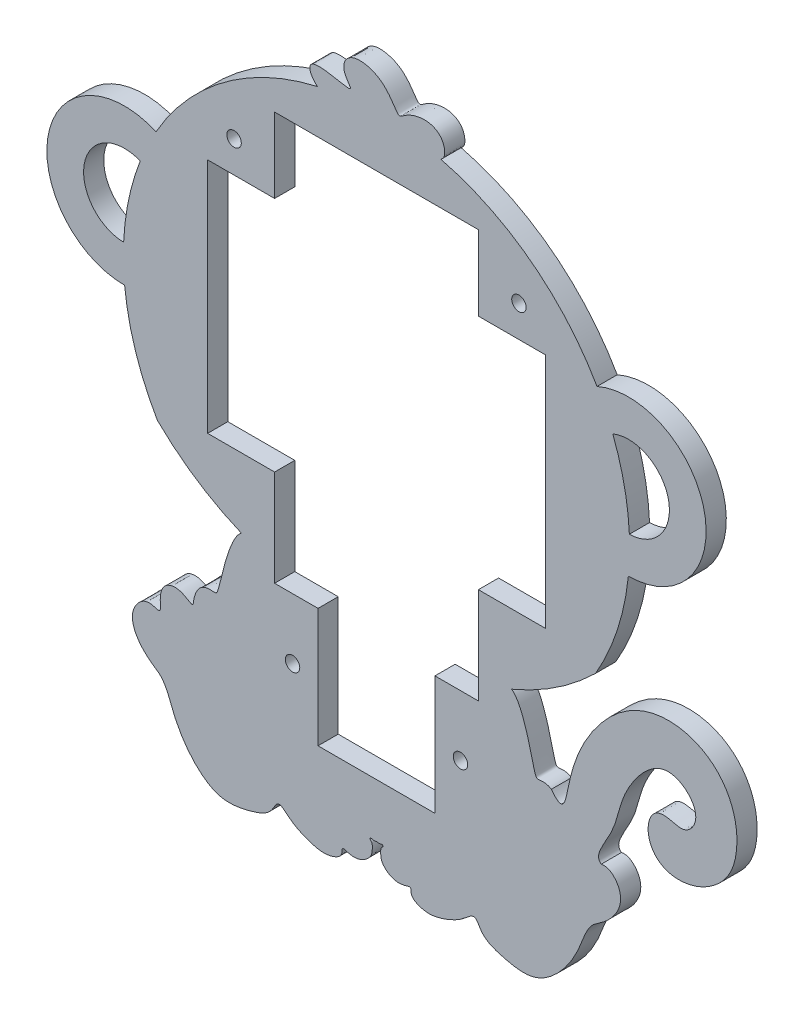
from build123d import *

# Parameters (mm, degrees)
MODEL_R             = 1.7
BOSS_EXTRUDE1_DEPTH = 4.75


with BuildPart() as part:
    # Model → Boss-Extrude1 (new body)
    with BuildSketch(Plane.XY):
        with BuildLine():
            add(Edge.make_bspline(
                [(-323.003936738, 396.327251189), (-322.639135583, 396.079204413), (-322.18920374, 395.634433922), (-321.658390696, 394.898644088), (-321.051857816, 393.757203334), (-320.383735374, 392.131003368), (-319.977262023, 391.014654975), (-319.584917193, 389.819275468), (-319.135868658, 388.323421516), (-318.721860717, 386.804935246), (-318.353600889, 385.34636593), (-318.038508773, 384.035346949), (-317.773489578, 382.944281063), (-317.579832511, 382.209449772), (-317.401157087, 381.664820315), (-317.218450591, 381.31109681), (-317.003689416, 381.129911234), (-316.721708308, 381.082225409), (-316.343707995, 381.115525432), (-315.861762853, 381.169472404), (-315.293993546, 381.182617586), (-314.716438841, 381.105097359), (-314.256472836, 380.951412883), (-313.932453608, 380.783648044), (-313.737120758, 380.657216991), (-313.6607794, 380.60362174)],
                knots=[0, 0, 0, 0, 0, 0, 0.02, 0.025, 0.03, 0.035, 0.04, 0.045, 0.05, 0.06, 0.065, 0.07, 0.075, 0.08, 0.085, 0.09, 0.095, 0.1, 0.105, 0.11, 0.115, 0.12, 0.123294018, 0.123294018, 0.123294018, 0.123294018, 0.123294018, 0.123294018], degree=5))
            ThreePointArc((-323.003936738, 396.327251189), (-312.498766528, 401.927835806), (-303.24831057, 409.421447336))
            ThreePointArc((-303.24831057, 409.421447336), (-298.124131535, 420.844790734), (-295.53920269, 433.095020448))
            ThreePointArc((-295.53920269, 433.095020448), (-277.643269068, 455.12113969), (-302.913653982, 468.037099404))
            ThreePointArc((-302.913653982, 468.037099404), (-318.490243046, 485.80537303), (-339.811140885, 495.991686882))
            add(Edge.make_bspline(
                [(-368.648535438, 496.252173352), (-368.744458236, 496.318852064), (-368.933155722, 496.46135137), (-369.206763211, 496.702529524), (-369.552638711, 497.078952875), (-369.945448044, 497.635151945), (-370.27396009, 498.258937778), (-370.49029081, 498.914952019), (-370.51070775, 499.541563445), (-370.238365938, 500.064302422), (-369.5990972, 500.417471707), (-368.57162488, 500.562380095), (-367.22355688, 500.508813977), (-365.687080465, 500.304348965), (-364.130399482, 500.021394498), (-362.730437113, 499.744991582), (-361.645780778, 499.560560003), (-360.987783845, 499.541133492), (-360.796409046, 499.736067669), (-361.003653893, 500.155847055), (-361.456239643, 500.775355547), (-361.969645158, 501.546412025), (-362.368346783, 502.406968262), (-362.540769792, 503.292531993), (-362.454363932, 504.143316727), (-362.127001431, 504.906996063), (-361.609010526, 505.54285956), (-360.962354705, 506.024792223), (-360.237689537, 506.346315269), (-359.465109655, 506.519028644), (-358.662050204, 506.563781119), (-357.836770513, 506.503364206), (-356.993360104, 506.355416269), (-356.136711355, 506.123246396), (-355.27524615, 505.794703449), (-354.419874931, 505.352916652), (-353.583850229, 504.783872945), (-352.782377599, 504.085819177), (-352.032065864, 503.276653785), (-351.351103862, 502.405268117), (-350.756796891, 501.550400765), (-350.259062752, 500.800910062), (-349.854900796, 500.240489256), (-349.52240587, 499.930593307), (-349.215031159, 499.894076524), (-348.855526802, 500.098537748), (-348.362085472, 500.475509867), (-347.67170771, 500.938251599), (-346.770031422, 501.402187782), (-345.688786994, 501.792289415), (-344.48987856, 502.045099565), (-343.253856136, 502.112491058), (-342.066559862, 501.964757688), (-341.006667622, 501.593968073), (-340.132609258, 501.01739116), (-339.470394525, 500.280534755), (-339.021946768, 499.447136213), (-338.772548612, 498.589873373), (-338.698846344, 497.780410896), (-338.775989921, 497.080683391), (-338.986639614, 496.531262609), (-339.255348506, 496.227388525), (-339.511863577, 496.0787419), (-339.707309513, 496.014838841), (-339.811140885, 495.991686882)],
                knots=[0, 0, 0, 0, 0, 0, 0.016666667, 0.033333333, 0.05, 0.066666667, 0.083333333, 0.1, 0.116666667, 0.133333333, 0.15, 0.166666667, 0.183333333, 0.2, 0.216666667, 0.233333333, 0.25, 0.266666667, 0.283333333, 0.3, 0.316666667, 0.333333333, 0.35, 0.366666667, 0.383333333, 0.4, 0.416666667, 0.433333333, 0.45, 0.466666667, 0.483333333, 0.5, 0.516666667, 0.533333333, 0.55, 0.566666667, 0.583333333, 0.6, 0.616666667, 0.633333333, 0.65, 0.666666667, 0.683333333, 0.7, 0.716666667, 0.733333333, 0.75, 0.766666667, 0.783333333, 0.8, 0.816666667, 0.833333333, 0.85, 0.866666667, 0.883333333, 0.9, 0.916666667, 0.933333333, 0.95, 0.966666667, 0.983333333, 1, 1, 1, 1, 1, 1], degree=5))
            ThreePointArc((-368.648535438, 496.252173352), (-390.614540969, 486.143224047), (-406.641533995, 468.037099404))
            ThreePointArc((-406.641533995, 468.037099404), (-431.911918909, 455.12113969), (-414.015985287, 433.095020448))
            ThreePointArc((-414.015985287, 433.095020448), (-411.431056442, 420.844790734), (-406.306877408, 409.421447336))
            ThreePointArc((-406.306877408, 409.421447336), (-397.05642145, 401.927835806), (-386.551251239, 396.327251189))
            add(Edge.make_bspline(
                [(-386.551251239, 396.327251189), (-386.916052394, 396.079204413), (-387.365984237, 395.634433922), (-387.896797281, 394.898644088), (-388.503330161, 393.757203334), (-389.171452603, 392.131003368), (-389.577925954, 391.014654975), (-389.970270784, 389.819275468), (-390.419319319, 388.323421516), (-390.83332726, 386.804935246), (-391.201587088, 385.34636593), (-391.516679205, 384.035346949), (-391.781698399, 382.944281063), (-391.975355466, 382.209449772), (-392.15403089, 381.664820315), (-392.336737386, 381.31109681), (-392.551498562, 381.129911234), (-392.833479669, 381.082225409), (-393.211479982, 381.115525432), (-393.693425125, 381.169472404), (-394.261194431, 381.182617586), (-394.881047474, 381.099420015), (-395.510435114, 380.877573231), (-396.105936728, 380.494485307), (-396.631517428, 379.95585235), (-397.063963964, 379.297531395), (-397.39210439, 378.573969962), (-397.617276013, 377.849585475), (-397.753517497, 377.188797135), (-397.82736951, 376.647023839), (-397.879059879, 376.260334721), (-397.959633552, 376.038465419), (-398.114782848, 375.972462073), (-398.366034123, 376.040823891), (-398.706936261, 376.21469148), (-399.120091801, 376.460086445), (-399.591458011, 376.741171495), (-400.117952431, 377.022315753), (-400.699774201, 377.268862798), (-401.463798734, 377.484035353), (-402.300244633, 377.553822048), (-403.174091852, 377.426716269), (-404.002173047, 377.065864722), (-404.698224792, 376.46441147), (-405.153470998, 375.811835942), (-405.461269956, 375.032169593), (-405.619922332, 374.166940367), (-405.657953521, 373.27889911), (-405.626485489, 372.442499072), (-405.587522811, 371.731075977), (-405.603727217, 371.205296174), (-405.727364814, 370.900755869), (-405.990085682, 370.81668236), (-406.39105056, 370.902146782), (-406.905602715, 371.07475403), (-407.496249881, 371.243305804), (-408.122207542, 371.327500075), (-408.751072773, 371.282728006), (-409.35960202, 371.097539496), (-409.931191749, 370.782809916), (-410.454421679, 370.36348433), (-410.921225043, 369.869653892), (-411.325051593, 369.32694511), (-411.659572418, 368.750331411), (-411.919102239, 368.147846593), (-412.098696202, 367.522400938), (-412.194371621, 366.874422897), (-412.203287138, 366.20397783), (-412.092164868, 365.237355517), (-411.795780763, 364.240492853), (-411.25356719, 363.0979097), (-410.505546493, 362.004000685), (-409.628552466, 361.020862692), (-408.940714048, 360.363039305), (-408.261699769, 359.795455705), (-407.719269628, 359.383631865), (-407.21381394, 359.028246689), (-406.753242924, 358.71792316), (-406.337217025, 358.432587935), (-405.958407604, 358.146100067), (-405.606436892, 357.832150323), (-405.270933307, 357.469037169), (-404.945150571, 357.045248498), (-404.628769556, 356.563710073), (-404.325203667, 356.036561227), (-404.039420225, 355.480831591), (-403.775511082, 354.913678765), (-403.486293011, 354.234906798), (-403.22438966, 353.563780813), (-402.971971356, 352.893055429), (-402.704512752, 352.203026621), (-402.401681187, 351.478012783), (-402.062584898, 350.721085445), (-401.674639208, 349.927966936), (-401.239024686, 349.111007443), (-400.763113802, 348.289788183), (-400.254340005, 347.481959495), (-399.722634495, 346.692998852), (-399.163365939, 345.932140679), (-398.574323946, 345.19923963), (-397.949478676, 344.488835597), (-397.28186749, 343.797089708), (-396.693729261, 343.232918759), (-395.94666487, 342.573889335), (-395.145878925, 341.947793479), (-394.290902186, 341.375211916), (-393.384167186, 340.882126765), (-392.430043668, 340.491703263), (-391.606002687, 340.243986907), (-390.756002743, 340.079446261), (-389.883129061, 339.998262902), (-388.990604918, 339.995014447), (-388.082210988, 340.060658996), (-387.162607569, 340.183979577), (-386.237707408, 340.353267946), (-385.315001235, 340.557855636), (-384.403963907, 340.789827334), (-383.516286063, 341.045384095), (-382.66652457, 341.327024633), (-381.871318875, 341.642937555), (-381.146754324, 342.002777686), (-380.506140062, 342.414272763), (-379.957720387, 342.879646699), (-379.50217975, 343.391768319), (-379.130782998, 343.931240964), (-378.821858803, 344.461005534), (-378.544703377, 344.932108886), (-378.267774642, 345.29593373), (-377.965518245, 345.51436395), (-377.625879138, 345.570992742), (-377.257148561, 345.481328236), (-376.875804119, 345.278776475), (-376.496250149, 345.00253689), (-376.11706805, 344.682307942), (-375.720845967, 344.335154988), (-375.283150649, 343.970625574), (-374.779103973, 343.593551859), (-374.190278948, 343.207542556), (-373.377688666, 342.741091189), (-372.449841911, 342.284943077), (-371.448923671, 341.861784637), (-370.434447105, 341.496921291), (-369.457107924, 341.211628122), (-368.685864943, 341.035221995), (-367.964373903, 340.924859402), (-367.285516994, 340.881136877), (-366.635919607, 340.902071878), (-366.001452121, 340.984188477), (-365.373937537, 341.123915256), (-364.75630659, 341.318535957), (-364.170945702, 341.568094094), (-363.657947564, 341.87428189), (-363.258368215, 342.235110671), (-362.999601239, 342.639822419), (-362.882834785, 343.065290294), (-362.862380856, 343.467877411), (-362.860328863, 343.794256059), (-362.800804618, 344.002021381), (-362.645316427, 344.082202864), (-362.403915174, 344.064482859), (-362.091030238, 343.983757423), (-361.712216892, 343.868949898), (-361.271123238, 343.746963048), (-360.772201451, 343.643387937), (-360.225145899, 343.584551667), (-359.643851104, 343.593953505), (-359.045609545, 343.68889199), (-358.331130904, 343.914571841), (-357.653031997, 344.271758954), (-357.055699253, 344.71601695), (-356.577458743, 345.17871164), (-356.233391408, 345.621031596), (-356.033125086, 345.975351534), (-355.902737419, 346.342883089), (-355.820827463, 346.757252518), (-355.769760706, 347.236551212), (-355.745106949, 347.759570584), (-355.762413964, 348.248781386), (-355.838587496, 348.623368474), (-355.977712536, 348.837568218), (-356.150848594, 348.941800594), (-356.292732028, 349.075710758), (-356.33646563, 349.288102762), (-356.236344626, 349.443149765), (-355.997125235, 349.455364951), (-355.677539018, 349.382302231), (-355.345578077, 349.318848286), (-355.1000792, 349.319880609), (-354.932396923, 349.356987082), (-354.827970147, 349.397996872), (-354.777593989, 349.422562594)],
                knots=[0, 0, 0, 0, 0, 0, 0.02, 0.025, 0.03, 0.035, 0.04, 0.045, 0.05, 0.06, 0.065, 0.07, 0.075, 0.08, 0.085, 0.09, 0.095, 0.1, 0.105, 0.11, 0.115, 0.12, 0.125, 0.13, 0.135, 0.14, 0.145, 0.15, 0.155, 0.16, 0.165, 0.17, 0.175, 0.18, 0.185, 0.19, 0.195, 0.2, 0.205, 0.21, 0.22, 0.225, 0.23, 0.235, 0.24, 0.245, 0.25, 0.255, 0.26, 0.265, 0.27, 0.275, 0.28, 0.285, 0.29, 0.295, 0.3, 0.305, 0.31, 0.315, 0.32, 0.325, 0.33, 0.335, 0.34, 0.345, 0.35, 0.355, 0.36, 0.375, 0.38, 0.39, 0.395, 0.4, 0.405, 0.41, 0.415, 0.42, 0.425, 0.43, 0.435, 0.44, 0.445, 0.45, 0.455, 0.46, 0.465, 0.47, 0.48, 0.485, 0.49, 0.495, 0.5, 0.51, 0.515, 0.52, 0.525, 0.53, 0.54, 0.545, 0.55, 0.555, 0.56, 0.565, 0.575, 0.58, 0.585, 0.59, 0.595, 0.6, 0.605, 0.61, 0.615, 0.62, 0.625, 0.63, 0.635, 0.64, 0.645, 0.65, 0.655, 0.66, 0.665, 0.67, 0.675, 0.68, 0.685, 0.69, 0.695, 0.7, 0.705, 0.71, 0.715, 0.72, 0.725, 0.73, 0.735, 0.74, 0.745, 0.755, 0.76, 0.765, 0.77, 0.775, 0.78, 0.785, 0.79, 0.795, 0.8, 0.805, 0.81, 0.815, 0.82, 0.825, 0.83, 0.835, 0.84, 0.845, 0.85, 0.855, 0.86, 0.865, 0.87, 0.875, 0.88, 0.885, 0.89, 0.895, 0.905, 0.91, 0.915, 0.92, 0.925, 0.93, 0.935, 0.94, 0.945, 0.95, 0.955, 0.96, 0.965, 0.97, 0.975, 0.98, 0.985, 0.99, 0.995, 1, 1, 1, 1, 1, 1], degree=5))
            add(Edge.make_bspline(
                [(-301.898947089, 371.249991702), (-301.80670497, 371.265018138), (-301.589974955, 371.293910279), (-301.244905456, 371.313674079), (-300.773941346, 371.273545454), (-300.195585957, 371.097539496), (-299.623996228, 370.782809916), (-299.100766299, 370.36348433), (-298.633962934, 369.869653892), (-298.230136384, 369.32694511), (-297.89561556, 368.750331411), (-297.636085738, 368.147846593), (-297.456491776, 367.522400938), (-297.360816357, 366.874422897), (-297.35190084, 366.20397783), (-297.463023109, 365.237355517), (-297.759407215, 364.240492853), (-298.301620787, 363.0979097), (-299.049641484, 362.004000685), (-299.926635511, 361.020862692), (-300.61447393, 360.363039305), (-301.293488209, 359.795455705), (-301.83591835, 359.383631865), (-302.341374037, 359.028246689), (-302.801945054, 358.71792316), (-303.217970952, 358.432587935), (-303.596780374, 358.146100067), (-303.948751085, 357.832150323), (-304.28425467, 357.469037169), (-304.610037406, 357.045248498), (-304.926418421, 356.563710073), (-305.22998431, 356.036561227), (-305.515767753, 355.480831591), (-305.779676896, 354.913678765), (-306.068894967, 354.234906798), (-306.330798317, 353.563780813), (-306.583216622, 352.893055429), (-306.850675225, 352.203026621), (-307.15350679, 351.478012783), (-307.492603079, 350.721085445), (-307.88054877, 349.927966936), (-308.316163291, 349.111007443), (-308.792074176, 348.289788183), (-309.300847972, 347.481959495), (-309.832553482, 346.692998852), (-310.391822039, 345.932140679), (-310.980864031, 345.19923963), (-311.605709301, 344.488835597), (-312.273320488, 343.797089708), (-312.861458716, 343.232918759), (-313.608523108, 342.573889335), (-314.409309053, 341.947793479), (-315.264285791, 341.375211916), (-316.171020791, 340.882126765), (-317.125144309, 340.491703263), (-317.949185291, 340.243986907), (-318.799185234, 340.079446261), (-319.672058916, 339.998262902), (-320.564583059, 339.995014447), (-321.472976989, 340.060658996), (-322.392580408, 340.183979577), (-323.31748057, 340.353267946), (-324.240186742, 340.557855636), (-325.151224071, 340.789827334), (-326.038901914, 341.045384095), (-326.888663407, 341.327024633), (-327.683869103, 341.642937555), (-328.408433654, 342.002777686), (-329.049047915, 342.414272763), (-329.59746759, 342.879646699), (-330.053008227, 343.391768319), (-330.42440498, 343.931240964), (-330.733329174, 344.461005534), (-331.0104846, 344.932108886), (-331.287413335, 345.29593373), (-331.589669732, 345.51436395), (-331.929308839, 345.570992742), (-332.298039416, 345.481328236), (-332.679383858, 345.278776475), (-333.058937829, 345.00253689), (-333.438119927, 344.682307942), (-333.83434201, 344.335154988), (-334.272037329, 343.970625574), (-334.776084004, 343.593551859), (-335.364909029, 343.207542556), (-336.177499311, 342.741091189), (-337.105346067, 342.284943077), (-338.106264306, 341.861784637), (-339.120740873, 341.496921291), (-340.098080053, 341.211628122), (-340.869323035, 341.035221995), (-341.590814074, 340.924859402), (-342.269670984, 340.881136877), (-342.91926837, 340.902071878), (-343.553735856, 340.984188477), (-344.18125044, 341.123915256), (-344.798881387, 341.318535957), (-345.384242276, 341.568094094), (-345.897240413, 341.87428189), (-346.296819762, 342.235110671), (-346.555586738, 342.639822419), (-346.672353193, 343.065290294), (-346.692807122, 343.467877411), (-346.694859114, 343.794256059), (-346.754383359, 344.002021381), (-346.909871551, 344.082202864), (-347.151272803, 344.064482859), (-347.46415774, 343.983757423), (-347.842971085, 343.868949898), (-348.284064739, 343.746963048), (-348.782986526, 343.643387937), (-349.330042079, 343.584551667), (-349.911336873, 343.593953505), (-350.509578433, 343.68889199), (-351.224057074, 343.914571841), (-351.902155981, 344.271758954), (-352.499488725, 344.71601695), (-352.977729235, 345.17871164), (-353.321796569, 345.621031596), (-353.522062892, 345.975351534), (-353.652450559, 346.342883089), (-353.734360514, 346.757252518), (-353.785427271, 347.236551212), (-353.810081029, 347.759570584), (-353.792774013, 348.248781386), (-353.716600481, 348.623368474), (-353.577475441, 348.837568218), (-353.404339383, 348.941800594), (-353.262455949, 349.075710758), (-353.218722348, 349.288102762), (-353.318843352, 349.443149765), (-353.558062742, 349.455364951), (-353.87764896, 349.382302231), (-354.2096099, 349.318848286), (-354.455108777, 349.319880609), (-354.622791055, 349.356987082), (-354.727217831, 349.397996872), (-354.777593989, 349.422562594)],
                knots=[0.291239622, 0.291239622, 0.291239622, 0.291239622, 0.291239622, 0.291239622, 0.295, 0.3, 0.305, 0.31, 0.315, 0.32, 0.325, 0.33, 0.335, 0.34, 0.345, 0.35, 0.355, 0.36, 0.375, 0.38, 0.39, 0.395, 0.4, 0.405, 0.41, 0.415, 0.42, 0.425, 0.43, 0.435, 0.44, 0.445, 0.45, 0.455, 0.46, 0.465, 0.47, 0.48, 0.485, 0.49, 0.495, 0.5, 0.51, 0.515, 0.52, 0.525, 0.53, 0.54, 0.545, 0.55, 0.555, 0.56, 0.565, 0.575, 0.58, 0.585, 0.59, 0.595, 0.6, 0.605, 0.61, 0.615, 0.62, 0.625, 0.63, 0.635, 0.64, 0.645, 0.65, 0.655, 0.66, 0.665, 0.67, 0.675, 0.68, 0.685, 0.69, 0.695, 0.7, 0.705, 0.71, 0.715, 0.72, 0.725, 0.73, 0.735, 0.74, 0.745, 0.755, 0.76, 0.765, 0.77, 0.775, 0.78, 0.785, 0.79, 0.795, 0.8, 0.805, 0.81, 0.815, 0.82, 0.825, 0.83, 0.835, 0.84, 0.845, 0.85, 0.855, 0.86, 0.865, 0.87, 0.875, 0.88, 0.885, 0.89, 0.895, 0.905, 0.91, 0.915, 0.92, 0.925, 0.93, 0.935, 0.94, 0.945, 0.95, 0.955, 0.96, 0.965, 0.97, 0.975, 0.98, 0.985, 0.99, 0.995, 1, 1, 1, 1, 1, 1], degree=5))
            add(Edge.make_bspline(
                [(-301.898947089, 371.249991702), (-302.03777992, 371.337842664), (-302.278358106, 371.535036125), (-302.527935786, 371.895313524), (-302.638326758, 372.504569396), (-302.422921716, 373.473093417), (-301.910810817, 374.622658725), (-301.203239072, 375.907021068), (-300.417430607, 377.272852531), (-299.663776374, 378.670412259), (-299.023340821, 380.063869225), (-298.518808306, 381.445147803), (-298.11469187, 382.832378816), (-297.742815902, 384.255163919), (-297.321372994, 385.743083541), (-296.774951218, 387.313965856), (-296.05819531, 388.959584105), (-295.162040147, 390.642897503), (-294.101045993, 392.307630147), (-292.906052001, 393.884476201), (-291.614267711, 395.298727975), (-290.261394711, 396.477163759), (-288.870633099, 397.355559995), (-287.450506474, 397.88487723), (-286.008600232, 398.034757091), (-284.562929688, 397.798008073), (-283.152043236, 397.193839546), (-281.851079655, 396.27377504), (-280.76403377, 395.118025382), (-279.993445178, 393.822748232), (-279.614594112, 392.489509944), (-279.651481692, 391.214486489), (-280.042701572, 390.076155472), (-280.672983329, 389.134306182), (-281.424791372, 388.432592409), (-282.224227316, 388.000042889), (-283.086509475, 387.852497186), (-284.061898655, 387.966698541), (-285.187617596, 388.257647228), (-286.432799241, 388.549506411), (-287.714778317, 388.627521421), (-288.922339625, 388.299673225), (-289.935960884, 387.451354667), (-290.650627543, 386.112012698), (-290.983205819, 384.420926362), (-290.877596402, 382.578851159), (-290.311010342, 380.803687119), (-289.299028152, 379.286710653), (-287.903220924, 378.142688713), (-286.219105708, 377.4170411), (-284.360670175, 377.103581142), (-282.445893609, 377.158636255), (-280.582328457, 377.516407907), (-278.851525965, 378.104383008), (-277.297305988, 378.856918007), (-275.93548394, 379.717384281), (-274.760882323, 380.641693853), (-273.755463023, 381.601444913), (-272.895776168, 382.586894991), (-272.161214125, 383.610945588), (-271.535866394, 384.70099922), (-271.009722971, 385.888830428), (-270.579877607, 387.201933377), (-270.252293644, 388.652401735), (-270.040978563, 390.2346489), (-269.965016257, 391.930118455), (-270.046205794, 393.710009769), (-270.306480744, 395.538773505), (-270.857132325, 397.745077765), (-271.727774145, 399.906931327), (-272.937052277, 401.94602382), (-274.485083983, 403.787796033), (-276.348901152, 405.366769995), (-278.092782759, 406.4785487), (-280.379149882, 407.539092006), (-283.265109328, 408.344541641), (-286.299006859, 408.594090842), (-289.32996603, 408.269637229), (-292.650761978, 407.269272218), (-295.374305071, 405.888080142), (-297.55376872, 404.384775694), (-299.570759796, 402.614165823), (-301.423227661, 400.629872898), (-302.855961089, 398.859622636), (-304.437971019, 396.623488316), (-305.836320205, 394.276384281), (-307.030109551, 391.853114628), (-308.001652746, 389.39378453), (-308.755268533, 386.963327702), (-309.250925564, 385.001542652), (-309.640561499, 383.162221439), (-309.968617434, 381.523898785), (-310.292721218, 380.178229359), (-310.673366326, 379.216827317), (-311.16584039, 378.72093299), (-311.809926861, 378.748147162), (-312.461695262, 379.21039337), (-313.030249288, 379.809050666), (-313.444699739, 380.320105618), (-313.6607794, 380.60362174)],
                knots=[0.011105874, 0.011105874, 0.011105874, 0.011105874, 0.011105874, 0.011105874, 0.021105874, 0.031105874, 0.041105874, 0.051105874, 0.061105874, 0.071105874, 0.081105874, 0.091105874, 0.101105874, 0.111105874, 0.121105874, 0.131105874, 0.141105874, 0.151105874, 0.161105874, 0.171105874, 0.181105874, 0.191105874, 0.201105874, 0.211105874, 0.221105874, 0.231105874, 0.241105874, 0.251105874, 0.261105874, 0.271105874, 0.281105874, 0.291105874, 0.301105874, 0.311105874, 0.321105874, 0.331105874, 0.341105874, 0.351105874, 0.361105874, 0.371105874, 0.381105874, 0.391105874, 0.401105874, 0.411105874, 0.421105874, 0.431105874, 0.441105874, 0.451105874, 0.461105874, 0.471105874, 0.481105874, 0.491105874, 0.501105874, 0.511105874, 0.521105874, 0.531105874, 0.541105874, 0.551105874, 0.561105874, 0.571105874, 0.581105874, 0.591105874, 0.601105874, 0.611105874, 0.621105874, 0.631105874, 0.641105874, 0.651105874, 0.661105874, 0.671105874, 0.681105874, 0.701105874, 0.711105874, 0.721105874, 0.731105874, 0.741105874, 0.751105874, 0.771105874, 0.791105874, 0.801105874, 0.811105874, 0.831105874, 0.841105874, 0.851105874, 0.861105874, 0.871105874, 0.881105874, 0.901105874, 0.911105874, 0.921105874, 0.931105874, 0.941105874, 0.951105874, 0.961105874, 0.971105874, 0.981105874, 0.991105874, 1.001105874, 1.011105874, 1.011105874, 1.011105874, 1.011105874, 1.011105874, 1.011105874], degree=5))
        make_face()
        Polygon((-368.527593989, 362.029236712), (-368.527593989, 390.029236712), (-378.744585616, 390.029236712), (-378.744585616, 412.69380901), (-394.493313544, 412.69380901), (-394.493313544, 468.407050822), (-378.744585616, 468.407050822), (-378.744585616, 486.018531516), (-330.810602362, 486.018531516), (-330.810602362, 468.407050822), (-315.061874433, 468.407050822), (-315.061874433, 412.69380901), (-330.810602362, 412.69380901), (-330.810602362, 390.029236712), (-341.027593989, 390.029236712), (-341.027593989, 362.029236712), align=None, mode=Mode.SUBTRACT)
        with Locations((-374.527593989, 375.779236712)):
            Circle(MODEL_R, mode=Mode.SUBTRACT)
        with Locations((-335.027593989, 375.779236712)):
            Circle(MODEL_R, mode=Mode.SUBTRACT)
        with Locations((-388.277593989, 475.779236712)):
            Circle(MODEL_R, mode=Mode.SUBTRACT)
        with Locations((-321.277593989, 475.779236712)):
            Circle(MODEL_R, mode=Mode.SUBTRACT)
        with BuildLine():
            ThreePointArc((-414.252942121, 441.734311673), (-423.460915188, 453.337573366), (-410.349392029, 460.23035295))
            ThreePointArc((-410.349392029, 460.23035295), (-413.050642353, 451.140507471), (-414.252942121, 441.734311673))
        make_face(mode=Mode.SUBTRACT)
        with BuildLine():
            ThreePointArc((-295.302245857, 441.734311673), (-296.504545624, 451.140507471), (-299.205795948, 460.23035295))
            ThreePointArc((-299.205795948, 460.23035295), (-286.094272789, 453.337573366), (-295.302245857, 441.734311673))
        make_face(mode=Mode.SUBTRACT)
    extrude(amount=BOSS_EXTRUDE1_DEPTH)


solid = part.part
